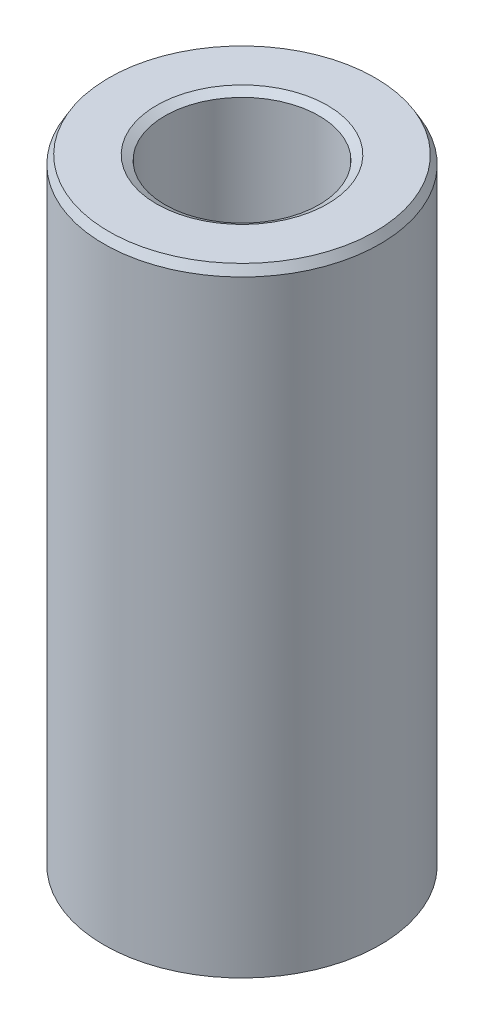
from build123d import *
from OCP.BRepFilletAPI import BRepFilletAPI_MakeChamfer

# Parameters (mm, degrees)
SKETCH1_R           = 52.5
BOSS_EXTRUDE1_DEPTH = 235.937378206
SKETCH2_R           = 29.312931835
CUT_EXTRUDE1_DEPTH  = 248.34378188
CHAMFER1_SIZE       = 3.192680362
CHAMFER1_SIZE2      = 1.843294867


with BuildPart() as part:
    # Sketch1 → Boss-Extrude1 (new body)
    with BuildSketch(Plane(origin=(0, 0, 0), x_dir=(1, 0, 0), z_dir=(0, 1, 0))):
        Circle(SKETCH1_R)
    extrude(amount=BOSS_EXTRUDE1_DEPTH)

    # Sketch2 → Cut-Extrude1 (cut, through all)
    with BuildSketch(Plane(origin=(0, 0, 0), x_dir=(1, 0, 0), z_dir=(0, 1, 0))):
        Circle(SKETCH2_R)
    extrude(amount=CUT_EXTRUDE1_DEPTH, mode=Mode.SUBTRACT)

    # Chamfer1: one chamfer whose edges measure the first distance from different faces: ONE call of the kernel's chamfer builder (chamfer() names one face for all edges)
    chamfer1_edges_1 = [part.edges().sort_by_distance(p)[0] for p in [
        (-29.312931835, 235.937378206, 0),
    ]]
    chamfer1_side_1 = [part.faces().sort_by_distance(p)[0] for p in [
        (-51.01507576, 235.937378206, 0),
    ]]
    chamfer1_edges_2 = [part.edges().sort_by_distance(p)[0] for p in [
        (-29.312931835, 0, 0),
    ]]
    chamfer1_side_2 = [part.faces().sort_by_distance(p)[0] for p in [
        (-29.312931835, 117.968689103, 0),
    ]]
    chamfer1_edges_3 = [part.edges().sort_by_distance(p)[0] for p in [
        (-52.5, 0, 0),
    ]]
    chamfer1_side_3 = [part.faces().sort_by_distance(p)[0] for p in [
        (-51.01507576, 0, 0),
    ]]
    chamfer1_edges_4 = [part.edges().sort_by_distance(p)[0] for p in [
        (-52.5, 235.937378206, 0),
    ]]
    chamfer1_side_4 = [part.faces().sort_by_distance(p)[0] for p in [
        (-52.5, 117.968689103, 0),
    ]]
    chamfer1 = BRepFilletAPI_MakeChamfer(part.part.solid().wrapped)
    for e in chamfer1_edges_1:
        chamfer1.Add(CHAMFER1_SIZE, CHAMFER1_SIZE2, e.wrapped, chamfer1_side_1[0].wrapped)  # the first distance lies on this face
    for e in chamfer1_edges_2:
        chamfer1.Add(CHAMFER1_SIZE, CHAMFER1_SIZE2, e.wrapped, chamfer1_side_2[0].wrapped)  # the first distance lies on this face
    for e in chamfer1_edges_3:
        chamfer1.Add(CHAMFER1_SIZE, CHAMFER1_SIZE2, e.wrapped, chamfer1_side_3[0].wrapped)  # the first distance lies on this face
    for e in chamfer1_edges_4:
        chamfer1.Add(CHAMFER1_SIZE, CHAMFER1_SIZE2, e.wrapped, chamfer1_side_4[0].wrapped)  # the first distance lies on this face
    add(Compound.cast(chamfer1.Shape()), mode=Mode.REPLACE)


solid = part.part
